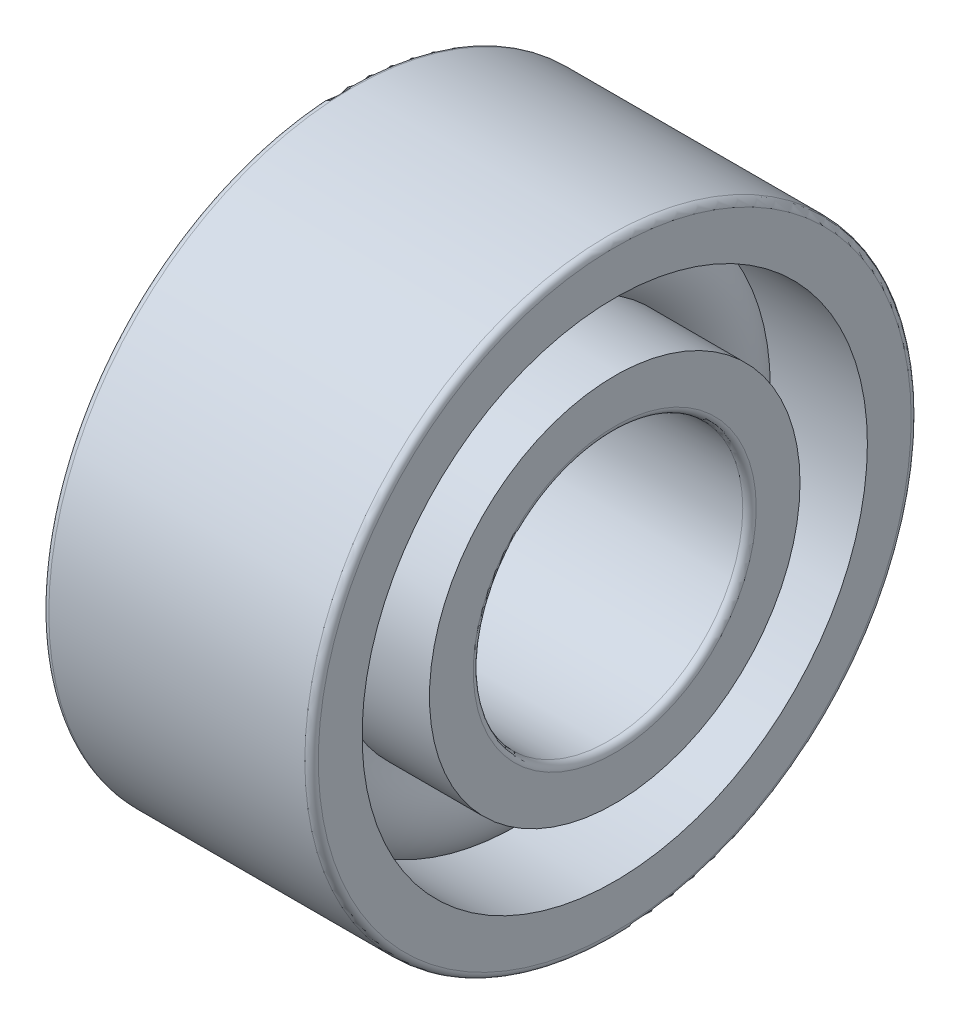
from build123d import *

# Parameters (mm, degrees)
CAGSPISKE_W     = 0.15
CAGSPISKE_H     = 0.25
CAGESPINE_ANGLE = 0.001
BALSIMSKE_R     = 0.75


with BuildPart() as part:
    # CagSpiSke → CageSpine (revolve)
    with BuildSketch(Plane.XY):
        with Locations((0, 3.25)):
            Rectangle(CAGSPISKE_W, CAGSPISKE_H)
    revolve(axis=Axis((-20.6375, 0, 0), (-1, 0, 0)), revolution_arc=CAGESPINE_ANGLE)

    # BalSimSke → BallsSimplified (revolve)
    with BuildSketch(Plane.XY):
        with Locations((0, 3.25)):
            Circle(BALSIMSKE_R)
    revolve(axis=Axis((-10, 0, 0), (1, 0, 0)))

    # InnRacSke → InnerRace (revolve)
    with BuildSketch(Plane.XY):
        with BuildLine():
            Line((-0.525, 2.75), (-2, 2.75))
            Line((-2, 2.75), (-2, 2.1))
            ThreePointArc((-2, 2.1), (-1.970710678, 2.029289322), (-1.9, 2))
            Line((-1.9, 2), (1.9, 2))
            ThreePointArc((1.9, 2), (1.970710678, 2.029289322), (2, 2.1))
            Line((2, 2.1), (2, 2.75))
            Line((2, 2.75), (0.525, 2.75))
            ThreePointArc((0.525, 2.75), (0, 2.525), (-0.525, 2.75))
        make_face()
    revolve(axis=Axis((-20.6375, 0, 0), (1, 0, 0)))

    # OutRacSke → OuterRace (revolve)
    with BuildSketch(Plane.XY):
        with BuildLine():
            Line((-0.525, 3.75), (-2, 3.75))
            Line((-2, 3.75), (-2, 4.4))
            ThreePointArc((-2, 4.4), (-1.970710678, 4.470710678), (-1.9, 4.5))
            Line((-1.9, 4.5), (1.9, 4.5))
            ThreePointArc((1.9, 4.5), (1.970710678, 4.470710678), (2, 4.4))
            Line((2, 4.4), (2, 3.75))
            Line((2, 3.75), (0.525, 3.75))
            ThreePointArc((0.525, 3.75), (0, 3.975), (-0.525, 3.75))
        make_face()
    revolve(axis=Axis((-20.6375, 0, 0), (1, 0, 0)))


solid = part.part
